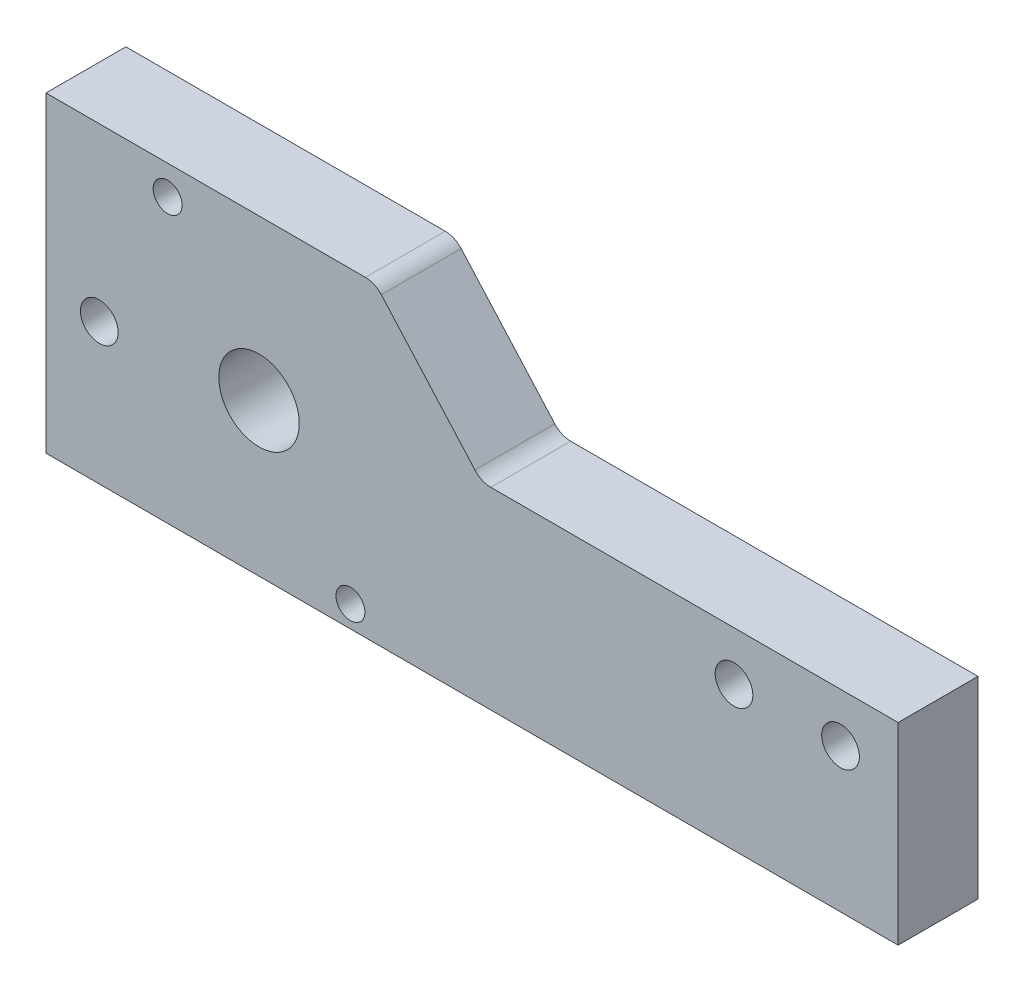
from build123d import *

# Parameters (mm, degrees)
SKETCH1_W                 = 101.6
SKETCH1_H                 = 50.8
BOSS_EXTRUDE1_DEPTH       = 9.525
SKETCH6_R                 = 4.8
CUT_EXTRUDE1_DEPTH        = 58.589283942
TAP_DRILL_FOR_8_32_TAP1_D = 3.4544
F_8_CLEARANCE_HOLE1_D     = 4.4958
SKETCH10_W                = 101.6
SKETCH10_H                = 37.138907791
CUT_EXTRUDE2_DEPTH        = 58.589283942
CUT_EXTRUDE3_DEPTH        = 58.589283942
FILLET1_R                 = 2.54
SKETCH12_R                = 2.2479
CUT_EXTRUDE4_DEPTH        = 58.589283942


with BuildPart() as part:
    # Sketch1 → Boss-Extrude1 (new body)
    with BuildSketch(Plane.XY):
        Rectangle(SKETCH1_W, SKETCH1_H)
    extrude(amount=BOSS_EXTRUDE1_DEPTH)

    # Sketch6 → Cut-Extrude1 (cut, through all)
    with BuildSketch(Plane.XY):
        with Locations((-25.4, 6.35)):
            Circle(SKETCH6_R)
    extrude(amount=CUT_EXTRUDE1_DEPTH, mode=Mode.SUBTRACT)

    # Tap Drill for #8-32 Tap1 (through all)
    with Locations(Plane.XY.offset(9.525)):
        with Locations((-14.502047709, -9.213888841), (-36.297952291, 21.913888841)):
            Hole(TAP_DRILL_FOR_8_32_TAP1_D / 2)

    # #8 Clearance Hole1 (through all)
    with Locations(Plane.XY.offset(9.525)):
        with Locations((31.231814057, 5.34348178), (43.931814057, 5.34348178)):
            Hole(F_8_CLEARANCE_HOLE1_D / 2)

    # Sketch10 → Cut-Extrude2 (cut, through all)
    with BuildSketch(Plane.XY.offset(9.525)):
        with Locations((0, -30.370972115)):
            Rectangle(SKETCH10_W, SKETCH10_H)
    extrude(amount=-CUT_EXTRUDE2_DEPTH, mode=Mode.SUBTRACT)

    # Sketch11 → Cut-Extrude3 (cut, through all)
    with BuildSketch(Plane.XY.offset(9.525)):
        Polygon((50.8, 11.193885079), (1.096095255, 11.193885079), (-11.576646979, 25.4), (50.8, 25.4), align=None)
    extrude(amount=-CUT_EXTRUDE3_DEPTH, mode=Mode.SUBTRACT)

    # Fillet1
    fillet1_edges = [part.edges().sort_by_distance(p)[0] for p in [
        (1.096095255, 11.193885079, 4.7625),
        (-11.576646979, 25.4, 4.7625),
    ]]
    fillet(fillet1_edges, radius=FILLET1_R)

    # Sketch12 → Cut-Extrude4 (cut, through all)
    with BuildSketch(Plane.XY.offset(9.525)):
        with Locations((-44.45, 4.964974194)):
            Circle(SKETCH12_R)
    extrude(amount=-CUT_EXTRUDE4_DEPTH, mode=Mode.SUBTRACT)


solid = part.part
